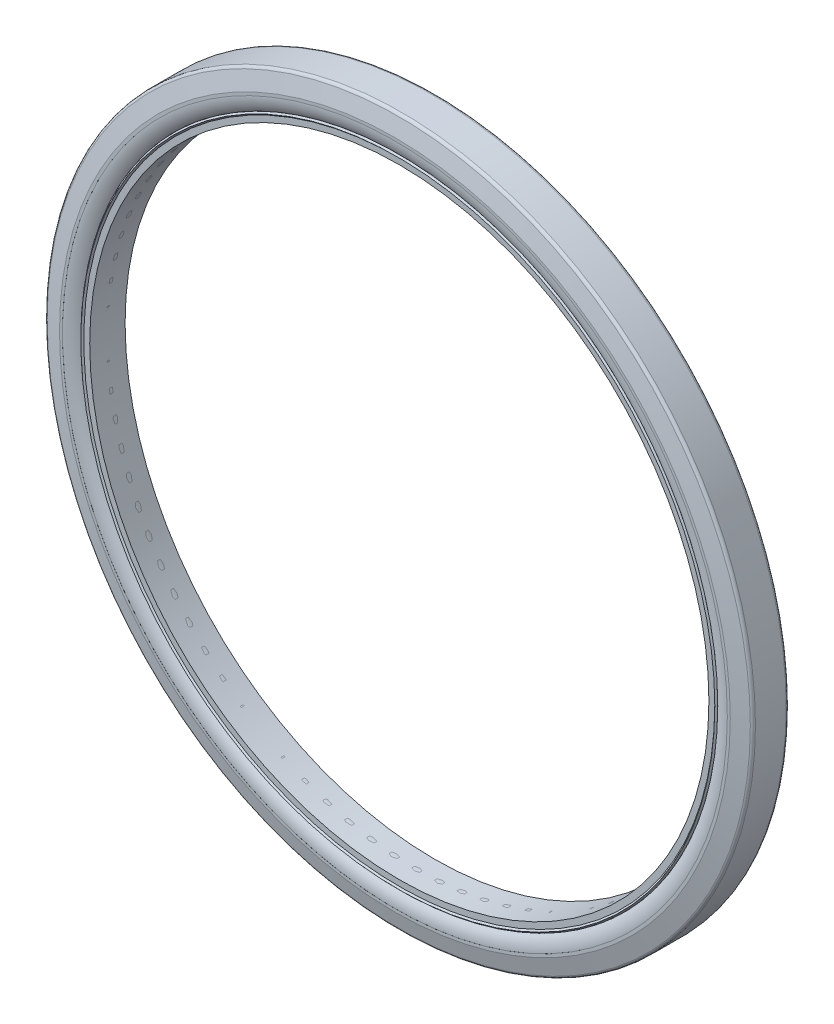
from build123d import *

# Parameters (mm, degrees)
SKETCH1_R = 1.5


with BuildPart() as part:
    # Sketch1 → Revolve1 (revolve)
    with BuildSketch(Plane(origin=(0, 0, 0), x_dir=(0, 0, -1), z_dir=(1, 0, 0))):
        with Locations((0, 22.5)):
            Circle(SKETCH1_R)
    revolve(axis=Axis((0, 0, 0), (0, 0, 1)))


with BuildPart() as body_2:
    # Sketch2 → SEAL RING Revolve2 (revolve)
    with BuildSketch(Plane(origin=(0, 0, 0), x_dir=(0, 0, -1), z_dir=(1, 0, 0))):
        with BuildLine():
            Line((-1.042320638, 24), (1.042320638, 24))
            ThreePointArc((1.042320638, 24), (1.166145276, 23.957058776), (1.236798098, 23.84667459))
            Line((1.236798098, 23.84667459), (1.5, 22.75))
            Line((1.5, 22.75), (1.5, 22.55))
            Line((1.5, 22.55), (1.2, 22.55))
            Line((1.2, 22.55), (1.2, 21.6))
            Line((1.2, 21.6), (1.3, 21.5))
            Line((1.3, 21.5), (1.2, 21.4))
            Line((1.2, 21.4), (1.2, 21))
            Line((1.2, 21), (-1.2, 21))
            Line((-1.2, 21), (-1.2, 21.4))
            Line((-1.2, 21.4), (-1.3, 21.5))
            Line((-1.3, 21.5), (-1.2, 21.6))
            Line((-1.2, 21.6), (-1.2, 22.55))
            Line((-1.2, 22.55), (-1.5, 22.55))
            Line((-1.5, 22.55), (-1.5, 22.75))
            Line((-1.5, 22.75), (-1.236798098, 23.84667459))
            ThreePointArc((-1.236798098, 23.84667459), (-1.166145276, 23.957058776), (-1.042320638, 24))
        make_face()
    revolve(axis=Axis((0, 0, 0), (0, 0, -1)))


solid = Compound([part.part, body_2.part])
